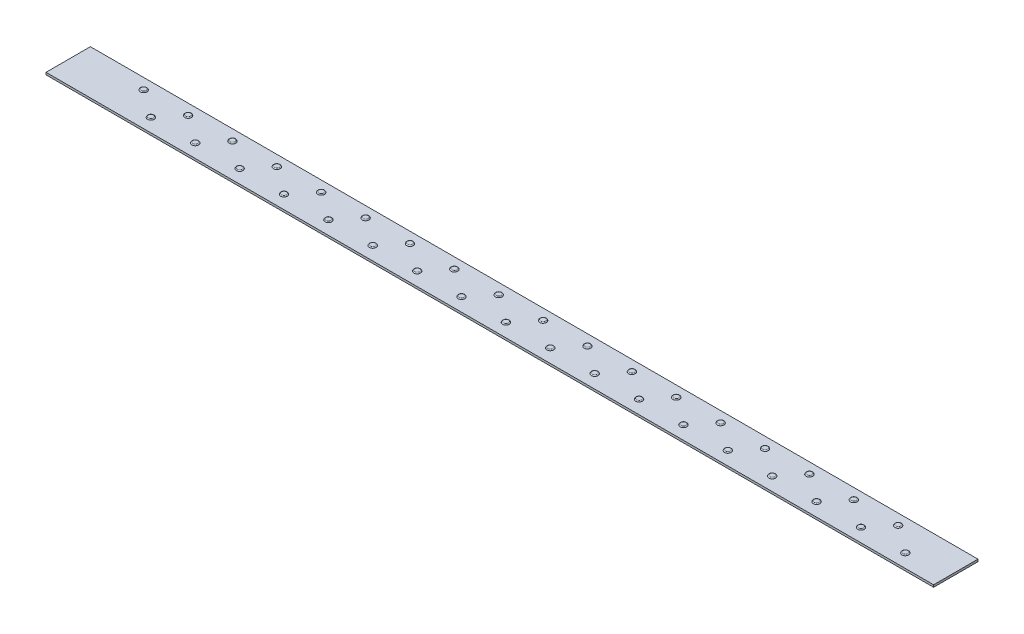
from build123d import *

# Parameters (mm, degrees)
CROQUIS1_W              = 40000
CROQUIS1_H              = 2000
SALIENTE_EXTRUIR1_DEPTH = 100
CROQUIS2_R              = 150
SALIENTE_EXTRUIR2_DEPTH = 40
REDONDEO1_R             = 40


with BuildPart() as part:
    # Croquis1 → Saliente-Extruir1 (new body)
    with BuildSketch(Plane(origin=(0, 0, 0), x_dir=(1, 0, 0), z_dir=(0, 1, 0))):
        Rectangle(CROQUIS1_W, CROQUIS1_H)
    extrude(amount=SALIENTE_EXTRUIR1_DEPTH)

    # Croquis2 → Saliente-Extruir2 (add)
    with BuildSketch(Plane(origin=(0, 100, 0), x_dir=(1, 0, 0), z_dir=(0, 1, 0))):
        with Locations(Location((-17108.052068539, 509.931430003, 0), (0, 0, 270))):
            Circle(CROQUIS2_R)
        with Locations(Location((-15874.270753097, -400, 0), (0, 0, 270))):
            Circle(CROQUIS2_R)
        with Locations(Location((-13874.270753097, -400, 0), (0, 0, 270))):
            Circle(CROQUIS2_R)
        with Locations(Location((-15108.052068539, 509.931430003, 0), (0, 0, 270))):
            Circle(CROQUIS2_R)
        with Locations(Location((-11874.270753097, -400, 0), (0, 0, 270))):
            Circle(CROQUIS2_R)
        with Locations(Location((-13108.052068539, 509.931430003, 0), (0, 0, 270))):
            Circle(CROQUIS2_R)
        with Locations(Location((-9874.270753097, -400, 0), (0, 0, 270))):
            Circle(CROQUIS2_R)
        with Locations(Location((-11108.052068539, 509.931430003, 0), (0, 0, 270))):
            Circle(CROQUIS2_R)
        with Locations(Location((-7874.270753097, -400, 0), (0, 0, 270))):
            Circle(CROQUIS2_R)
        with Locations(Location((-9108.052068539, 509.931430003, 0), (0, 0, 270))):
            Circle(CROQUIS2_R)
        with Locations(Location((-5874.270753097, -400, 0), (0, 0, 270))):
            Circle(CROQUIS2_R)
        with Locations(Location((-7108.052068539, 509.931430003, 0), (0, 0, 270))):
            Circle(CROQUIS2_R)
        with Locations(Location((-3874.270753097, -400, 0), (0, 0, 270))):
            Circle(CROQUIS2_R)
        with Locations(Location((-5108.052068539, 509.931430003, 0), (0, 0, 270))):
            Circle(CROQUIS2_R)
        with Locations(Location((-1874.270753097, -400, 0), (0, 0, 270))):
            Circle(CROQUIS2_R)
        with Locations(Location((-3108.052068539, 509.931430003, 0), (0, 0, 270))):
            Circle(CROQUIS2_R)
        with Locations(Location((125.729246903, -400, 0), (0, 0, 270))):
            Circle(CROQUIS2_R)
        with Locations(Location((-1108.052068539, 509.931430003, 0), (0, 0, 270))):
            Circle(CROQUIS2_R)
        with Locations(Location((2125.729246903, -400, 0), (0, 0, 270))):
            Circle(CROQUIS2_R)
        with Locations(Location((891.947931461, 509.931430003, 0), (0, 0, 270))):
            Circle(CROQUIS2_R)
        with Locations(Location((4125.729246903, -400, 0), (0, 0, 270))):
            Circle(CROQUIS2_R)
        with Locations(Location((2891.947931461, 509.931430003, 0), (0, 0, 270))):
            Circle(CROQUIS2_R)
        with Locations(Location((6125.729246903, -400, 0), (0, 0, 270))):
            Circle(CROQUIS2_R)
        with Locations(Location((4891.947931461, 509.931430003, 0), (0, 0, 270))):
            Circle(CROQUIS2_R)
        with Locations(Location((8125.729246903, -400, 0), (0, 0, 270))):
            Circle(CROQUIS2_R)
        with Locations(Location((6891.947931461, 509.931430003, 0), (0, 0, 270))):
            Circle(CROQUIS2_R)
        with Locations(Location((10125.729246903, -400, 0), (0, 0, 270))):
            Circle(CROQUIS2_R)
        with Locations(Location((8891.947931461, 509.931430003, 0), (0, 0, 270))):
            Circle(CROQUIS2_R)
        with Locations(Location((12125.729246903, -400, 0), (0, 0, 270))):
            Circle(CROQUIS2_R)
        with Locations(Location((10891.947931461, 509.931430003, 0), (0, 0, 270))):
            Circle(CROQUIS2_R)
        with Locations(Location((14125.729246903, -400, 0), (0, 0, 270))):
            Circle(CROQUIS2_R)
        with Locations(Location((12891.947931461, 509.931430003, 0), (0, 0, 270))):
            Circle(CROQUIS2_R)
        with Locations(Location((16125.729246903, -400, 0), (0, 0, 270))):
            Circle(CROQUIS2_R)
        with Locations(Location((14891.947931461, 509.931430003, 0), (0, 0, 270))):
            Circle(CROQUIS2_R)
        with Locations(Location((18125.729246903, -400, 0), (0, 0, 270))):
            Circle(CROQUIS2_R)
        with Locations(Location((16891.947931461, 509.931430003, 0), (0, 0, 270))):
            Circle(CROQUIS2_R)
    extrude(amount=SALIENTE_EXTRUIR2_DEPTH)

    # Redondeo1
    redondeo1_edges = [part.edges().sort_by_distance(p)[0] for p in [
        (10891.947931461, 140, -659.931430003),
        (12125.729246903, 140, 250),
        (12891.947931461, 140, -659.931430003),
        (14125.729246903, 140, 250),
        (14891.947931461, 140, -659.931430003),
        (16125.729246903, 140, 250),
        (16891.947931461, 140, -659.931430003),
        (18125.729246903, 140, 250),
        (-17108.052068539, 140, -659.931430003),
        (-15874.270753097, 140, 250),
        (-15108.052068539, 140, -659.931430003),
        (-13874.270753097, 140, 250),
        (-13108.052068539, 140, -659.931430003),
        (-11874.270753097, 140, 250),
        (-11108.052068539, 140, -659.931430003),
        (-9874.270753097, 140, 250),
        (-9108.052068539, 140, -659.931430003),
        (-7874.270753097, 140, 250),
        (-7108.052068539, 140, -659.931430003),
        (-5874.270753097, 140, 250),
        (-5108.052068539, 140, -659.931430003),
        (-3874.270753097, 140, 250),
        (-3108.052068539, 140, -659.931430003),
        (-1874.270753097, 140, 250),
        (-1108.052068539, 140, -659.931430003),
        (125.729246903, 140, 250),
        (891.947931461, 140, -659.931430003),
        (2125.729246903, 140, 250),
        (2891.947931461, 140, -659.931430003),
        (4125.729246903, 140, 250),
        (4891.947931461, 140, -659.931430003),
        (6125.729246903, 140, 250),
        (6891.947931461, 140, -659.931430003),
        (8125.729246903, 140, 250),
        (8891.947931461, 140, -659.931430003),
        (10125.729246903, 140, 250),
    ]]
    fillet(redondeo1_edges, radius=REDONDEO1_R - 0.0001)  # a hair under: the kernel refuses the full size


solid = part.part
